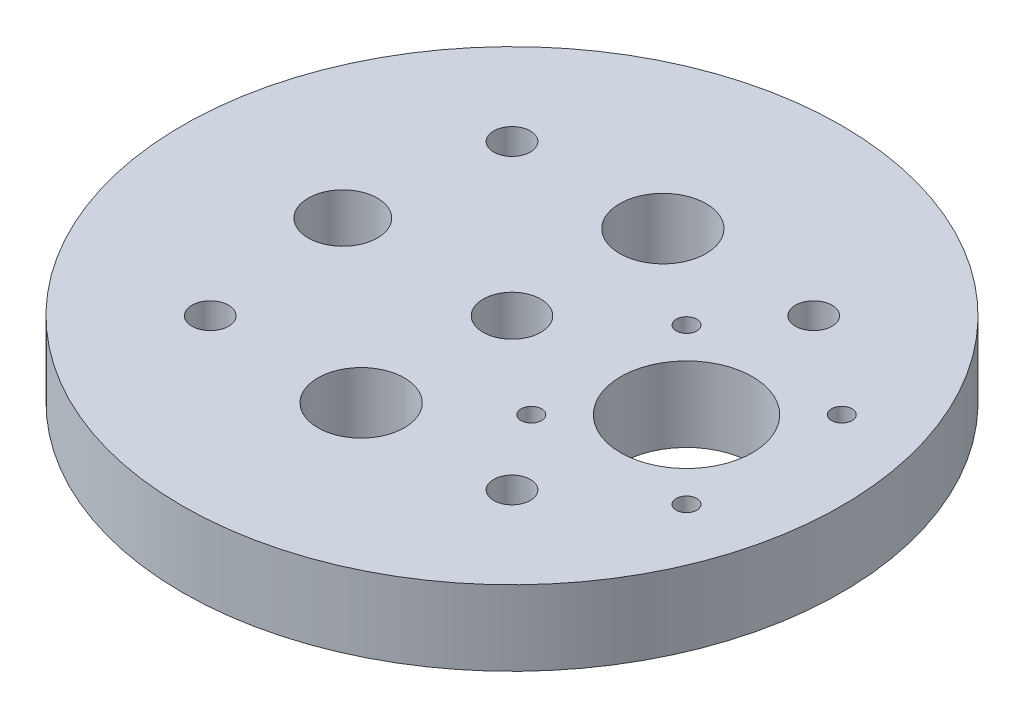
from build123d import *

# Parameters (mm, degrees)
SKETCH2_R           = 57.15
BOSS_EXTRUDE1_DEPTH = 13
CUT_EXTRUDE1_REACH  = 83.861
SKETCH6_R           = 3.175
SKETCH7_R           = 11.43
SKETCH7_R_2         = 1.778
CUT_EXTRUDE2_DEPTH  = 82.861132413
SKETCH8_R           = 7.5
SKETCH8_R_2         = 5
SKETCH8_R_3         = 6
CUT_EXTRUDE3_DEPTH  = 82.861132413


with BuildPart() as part:
    # Sketch2 → Boss-Extrude1 (new body)
    with BuildSketch(Plane(origin=(0, 0, 0), x_dir=(1, 0, 0), z_dir=(0, 1, 0))):
        Circle(SKETCH2_R)
    extrude(amount=BOSS_EXTRUDE1_DEPTH)

    # Sketch6 → Cut-Extrude1 (cut, up to next)
    with BuildSketch(Plane(origin=(0, 13, 0), x_dir=(1, 0, 0), z_dir=(0, 1, 0)), mode=Mode.PRIVATE) as cut_extrude1_sk1:
        with Locations((-26.1629, -26.1629)):
            Circle(SKETCH6_R)
    cut_extrude1_tool1 = extrude(cut_extrude1_sk1.sketch, amount=-CUT_EXTRUDE1_REACH, mode=Mode.PRIVATE) & part.part
    # Sketch6 → Cut-Extrude1 (cut, up to next)
    with BuildSketch(Plane(origin=(0, 13, 0), x_dir=(1, 0, 0), z_dir=(0, 1, 0)), mode=Mode.PRIVATE) as cut_extrude1_sk2:
        with Locations((26.1629, -26.1629)):
            Circle(SKETCH6_R)
    cut_extrude1_tool2 = extrude(cut_extrude1_sk2.sketch, amount=-CUT_EXTRUDE1_REACH, mode=Mode.PRIVATE) & part.part
    # Sketch6 → Cut-Extrude1 (cut, up to next)
    with BuildSketch(Plane(origin=(0, 13, 0), x_dir=(1, 0, 0), z_dir=(0, 1, 0)), mode=Mode.PRIVATE) as cut_extrude1_sk3:
        with Locations((-26.1629, 26.163103615)):
            Circle(SKETCH6_R)
    cut_extrude1_tool3 = extrude(cut_extrude1_sk3.sketch, amount=-CUT_EXTRUDE1_REACH, mode=Mode.PRIVATE) & part.part
    # Sketch6 → Cut-Extrude1 (cut, up to next)
    with BuildSketch(Plane(origin=(0, 13, 0), x_dir=(1, 0, 0), z_dir=(0, 1, 0)), mode=Mode.PRIVATE) as cut_extrude1_sk4:
        with Locations((26.1629, 26.163103615)):
            Circle(SKETCH6_R)
    cut_extrude1_tool4 = extrude(cut_extrude1_sk4.sketch, amount=-CUT_EXTRUDE1_REACH, mode=Mode.PRIVATE) & part.part
    add(cut_extrude1_tool1.solids().sort_by_distance((-26.1629, 13, 26.1629))[0], mode=Mode.SUBTRACT)
    add(cut_extrude1_tool2.solids().sort_by_distance((26.1629, 13, 26.1629))[0], mode=Mode.SUBTRACT)
    add(cut_extrude1_tool3.solids().sort_by_distance((-26.1629, 13, -26.163104))[0], mode=Mode.SUBTRACT)
    add(cut_extrude1_tool4.solids().sort_by_distance((26.1629, 13, -26.163104))[0], mode=Mode.SUBTRACT)

    # Sketch7 → Cut-Extrude2 (cut, through all)
    with BuildSketch(Plane(origin=(0, 13, 0), x_dir=(1, 0, 0), z_dir=(0, 1, 0))):
        with Locations((30, 0.269903496)):
            Circle(SKETCH7_R)
        with Locations((16.54, -13.194096504)):
            Circle(SKETCH7_R_2)
        with Locations((16.54, 13.729903496)):
            Circle(SKETCH7_R_2)
        with Locations((43.46, 13.729903496)):
            Circle(SKETCH7_R_2)
        with Locations((43.46, -13.194096504)):
            Circle(SKETCH7_R_2)
    extrude(amount=-CUT_EXTRUDE2_DEPTH, mode=Mode.SUBTRACT)

    # Sketch8 → Cut-Extrude3 (cut, through all)
    with BuildSketch(Plane(origin=(0, 13, 0), x_dir=(1, 0, 0), z_dir=(0, 1, 0))):
        with Locations((0, -26.1629)):
            Circle(SKETCH8_R)
        with Locations((0, 26.163103615)):
            Circle(SKETCH8_R)
        Circle(SKETCH8_R_2)
        with Locations((-29.3379, 0)):
            Circle(SKETCH8_R_3)
    extrude(amount=-CUT_EXTRUDE3_DEPTH, mode=Mode.SUBTRACT)


solid = part.part
